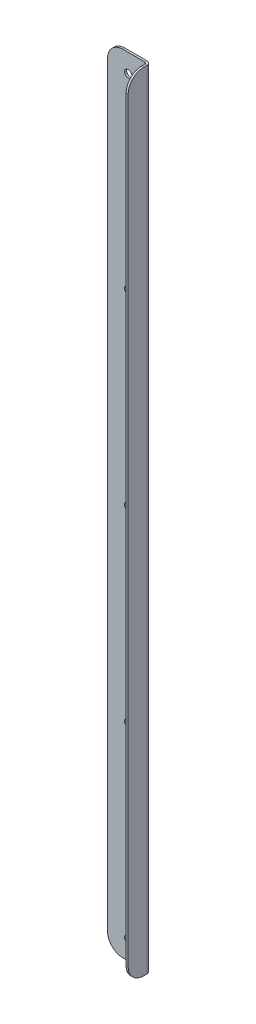
from build123d import *

# Parameters (mm, degrees)
SKETCH2_W                    = 40
SKETCH2_H                    = 761
BASE_FLANGE1_DEPTH           = 2
EDGE_FLANGE1_STRIP_W         = 12
EDGE_FLANGE1_STRIP_H         = 2
EDGE_FLANGE1_STRIP_CUT_DEPTH = 761
EDGE_FLANGE1_DEPTH           = 761
FILLET1_R                    = 15
F_7_0_7_DIAMETER_HOLE1_D     = 7


# Sheet-metal steps are written as plain solids
with BuildPart() as part:
    # Sketch2 → Base-Flange1 (new body)
    with BuildSketch(Plane.XY):
        Rectangle(SKETCH2_W, SKETCH2_H)
    extrude(amount=-BASE_FLANGE1_DEPTH)

    # Edge-Flange1 strip (across the edge) → Edge-Flange1 strip cut (cut)
    with BuildSketch(Plane(origin=(20, -380.5, 0), x_dir=(-1, 0, 0), z_dir=(0, 1, 0))):
        with Locations((-2, -1)):
            Rectangle(EDGE_FLANGE1_STRIP_W, EDGE_FLANGE1_STRIP_H)
    extrude(amount=EDGE_FLANGE1_STRIP_CUT_DEPTH, mode=Mode.SUBTRACT)

    # Edge-Flange1 section (across the edge) → Edge-Flange1 (add)
    with BuildSketch(Plane(origin=(20, -380.5, 0), x_dir=(-1, 0, 0), z_dir=(0, 1, 0))):
        with BuildLine():
            Line((0, 2), (0, 20))
            Line((0, 20), (2, 20))
            Line((2, 20), (2, 2))
            ThreePointArc((2, 2), (2.585786438, 0.585786438), (4, 0))
            Line((4, 0), (4, -2))
            ThreePointArc((4, -2), (1.171572875, -0.828427125), (0, 2))
        make_face()
    extrude(amount=EDGE_FLANGE1_DEPTH)

    # Fillet1
    fillet1_edges = [part.edges().sort_by_distance(p)[0] for p in [
        (19, -380.5, 20),
        (19, 380.5, 20),
        (-20, -380.5, -1),
        (-20, 380.5, -1),
    ]]
    fillet(fillet1_edges, radius=FILLET1_R)

    # Ø7.0 (7) Diameter Hole1 (through all)
    with Locations(Plane.XY):
        with Locations((0, 362.5), (0, 181.25), (0, 0), (0, -181.25), (0, -362.5)):
            Hole(F_7_0_7_DIAMETER_HOLE1_D / 2)


solid = part.part
